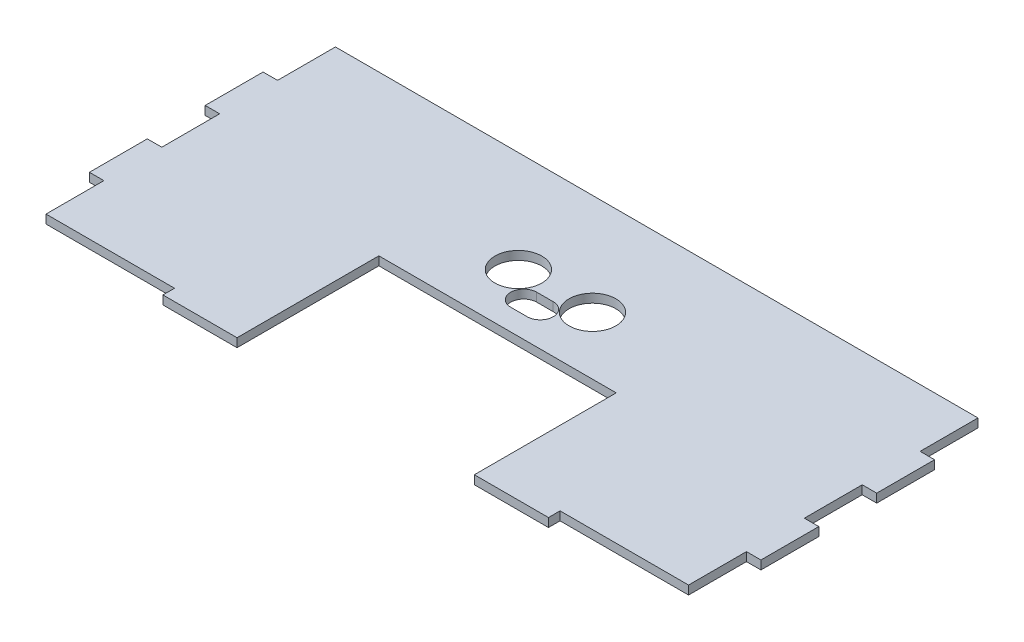
from build123d import *

# Parameters (mm, degrees)
SKETCH1_R           = 8.1
BOSS_EXTRUDE1_DEPTH = 3


with BuildPart() as part:
    # Sketch1 → Boss-Extrude1 (new body)
    with BuildSketch(Plane(origin=(0, 0, 0), x_dir=(1, 0, 0), z_dir=(0, 1, 0))):
        Polygon((-111, 30), (-116, 30), (-116, 10), (-111, 10), (-111, -10), (-116, -10), (-116, -30), (-111, -30), (-111, -50), (-66.6, -50), (-66.6, -54), (-41, -54), (-41, -5), (41, -5), (41, -54), (66.6, -54), (66.6, -50), (111, -50), (111, -30), (116, -30), (116, -10), (111, -10), (111, 10), (116, 10), (116, 30), (111, 30), (111, 50), (-111, 50), align=None)
        with Locations((12.8, 15)):
            Circle(SKETCH1_R, mode=Mode.SUBTRACT)
        with Locations((-12.8, 15)):
            Circle(SKETCH1_R, mode=Mode.SUBTRACT)
        with BuildLine():
            Line((-2.85, 2.4), (2.85, 2.4))
            ThreePointArc((2.85, 2.4), (7.35, 6.9), (2.85, 11.4))
            Line((2.85, 11.4), (-2.85, 11.4))
            ThreePointArc((-2.85, 11.4), (-7.35, 6.9), (-2.85, 2.4))
        make_face(mode=Mode.SUBTRACT)
    extrude(amount=BOSS_EXTRUDE1_DEPTH)


solid = part.part
